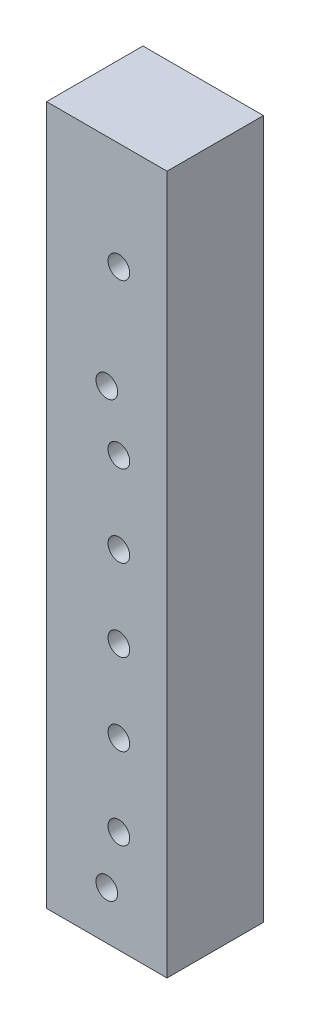
from build123d import *

# Parameters (mm, degrees)
SKETCH_1_W              = 15
SKETCH_1_H              = 12
EXTRUDE_1_DEPTH         = 87
HOLE_WIZARD_2_7_2_7_2_D = 2.7
HOLE_WIZARD_2_7_2_7_1_D = 2.7
HOLE_WIZARD_2_7_2_7_3_D = 2.7


with BuildPart() as part:
    # 草圖1 → 填料-伸長1 (new body)
    with BuildSketch(Plane(origin=(0, 0, 0), x_dir=(1, 0, 0), z_dir=(0, 1, 0))):
        Rectangle(SKETCH_1_W, SKETCH_1_H)
    extrude(amount=EXTRUDE_1_DEPTH)

    # Ø2.7 (2.7) 直徑孔2 (through all)
    with Locations(Plane(origin=(1.5, 12.73, -6), x_dir=(-1, 0, 0), z_dir=(0, 0, -1))):
        with Locations((0, 0), (0, 20.32), (0, 40.64), (0, 60.96)):
            Hole(HOLE_WIZARD_2_7_2_7_2_D / 2)

    # Ø2.7 (2.7) 直徑孔1 (through all)
    with Locations(Plane(origin=(0, 60.1, -6), x_dir=(-1, 0, 0), z_dir=(0, 0, -1))):
        with Locations((0, 0), (0, -54.1)):
            Hole(HOLE_WIZARD_2_7_2_7_1_D / 2)

    # Ø2.7 (2.7) 直徑孔3 (through all)
    with Locations(Plane(origin=(1.5, 22.89, -6), x_dir=(-1, 0, 0), z_dir=(0, 0, -1))):
        with Locations((0, 0), (0, 20.32)):
            Hole(HOLE_WIZARD_2_7_2_7_3_D / 2)


solid = part.part
